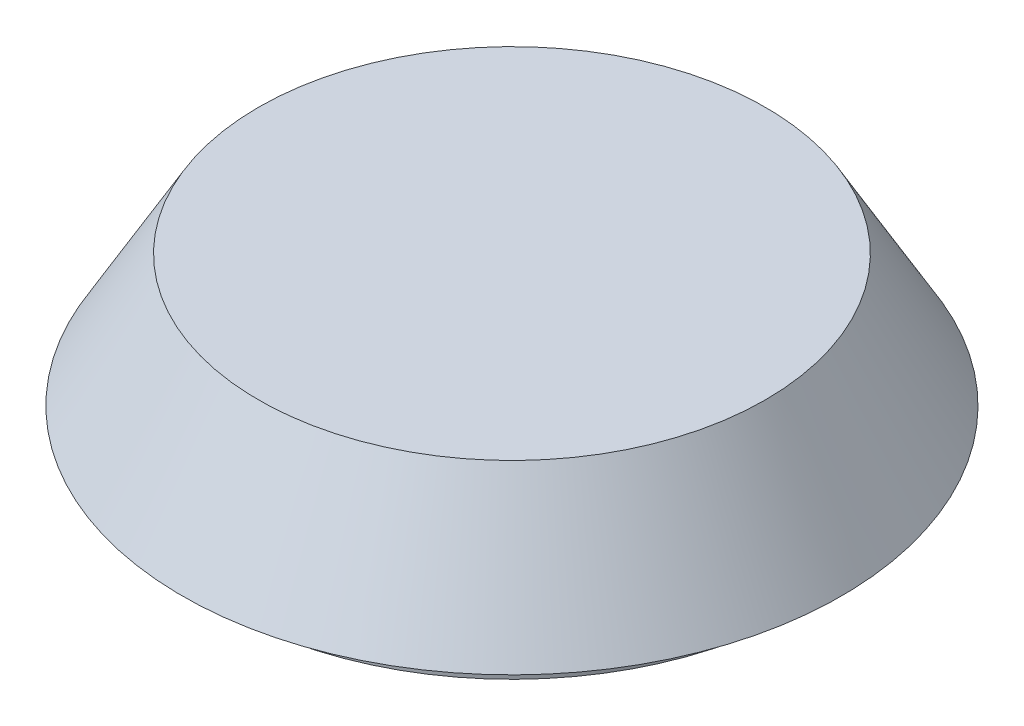
from build123d import *

# Parameters (mm, degrees)
SKETCH2_R           = 43.85
BOSS_EXTRUDE1_DEPTH = 5
BOSS_EXTRUDE1_DRAFT = -1


with BuildPart() as part:
    # Sketch2 → Boss-Extrude1 (with draft: the straight prism first)
    with BuildSketch(Plane(origin=(0, 0, 0), x_dir=(1, 0, 0), z_dir=(0, 1, 0))):
        Circle(SKETCH2_R)
    extrude(amount=-BOSS_EXTRUDE1_DEPTH)
    # Boss-Extrude1: the draft: its side faces are tilted about the plane it starts from
    boss_extrude1_sides = [part.faces().sort_by_distance(p)[0] for p in [
        (-43.85, -2.5, 0),
    ]]
    draft(boss_extrude1_sides, Plane(origin=(0, 0, 0), x_dir=(1, 0, 0), z_dir=(0, 1, 0)), BOSS_EXTRUDE1_DRAFT)

    # Sketch4 → Revolve1 (revolve)
    with BuildSketch(Plane.XY):
        Polygon((0, 0), (50, 0), (38.452994616, 20), (0, 20), align=None)
    revolve(axis=Axis((0, 20, 0), (0, -1, 0)))


solid = part.part
